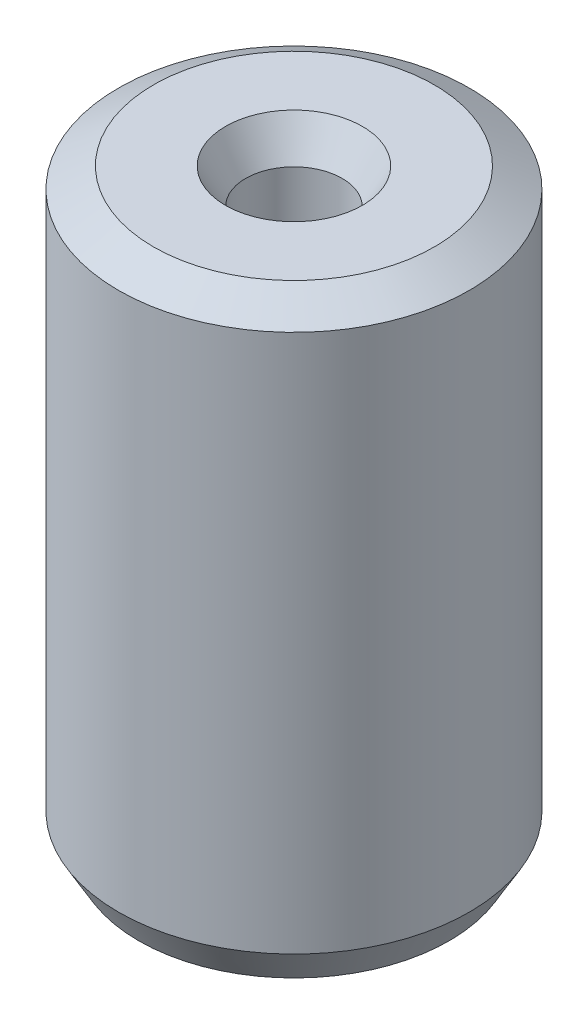
from build123d import *
from OCP.BRepFilletAPI import BRepFilletAPI_MakeChamfer

# Parameters (mm, degrees)
SKETCH1_R           = 5
BOSS_EXTRUDE1_DEPTH = 16.924427197
SKETCH2_R           = 1.376267349
CUT_EXTRUDE1_DEPTH  = 19.342198231
CHAMFER1_SIZE       = 0.575378494
CHAMFER1_SIZE2      = 0.996584786


with BuildPart() as part:
    # Sketch1 → Boss-Extrude1 (new body)
    with BuildSketch(Plane(origin=(0, 0, 0), x_dir=(1, 0, 0), z_dir=(0, 1, 0))):
        Circle(SKETCH1_R)
    extrude(amount=BOSS_EXTRUDE1_DEPTH)

    # Sketch2 → Cut-Extrude1 (cut, through all)
    with BuildSketch(Plane(origin=(0, 0, 0), x_dir=(1, 0, 0), z_dir=(0, 1, 0))):
        Circle(SKETCH2_R)
    extrude(amount=CUT_EXTRUDE1_DEPTH, mode=Mode.SUBTRACT)

    # Chamfer1: one chamfer whose edges measure the first distance from different faces: ONE call of the kernel's chamfer builder (chamfer() names one face for all edges)
    chamfer1_edges_1 = [part.edges().sort_by_distance(p)[0] for p in [
        (-1.376267349, 16.924427197, 0),
    ]]
    chamfer1_side_1 = [part.faces().sort_by_distance(p)[0] for p in [
        (-4.858578644, 16.924427197, 0),
    ]]
    chamfer1_edges_2 = [part.edges().sort_by_distance(p)[0] for p in [
        (-1.376267349, 0, 0),
    ]]
    chamfer1_side_2 = [part.faces().sort_by_distance(p)[0] for p in [
        (-1.376267349, 8.462213598, 0),
    ]]
    chamfer1_edges_3 = [part.edges().sort_by_distance(p)[0] for p in [
        (-5, 0, 0),
    ]]
    chamfer1_side_3 = [part.faces().sort_by_distance(p)[0] for p in [
        (-4.858578644, 0, 0),
    ]]
    chamfer1_edges_4 = [part.edges().sort_by_distance(p)[0] for p in [
        (-5, 16.924427197, 0),
    ]]
    chamfer1_side_4 = [part.faces().sort_by_distance(p)[0] for p in [
        (-5, 8.462213598, 0),
    ]]
    chamfer1 = BRepFilletAPI_MakeChamfer(part.part.solid().wrapped)
    for e in chamfer1_edges_1:
        chamfer1.Add(CHAMFER1_SIZE, CHAMFER1_SIZE2, e.wrapped, chamfer1_side_1[0].wrapped)  # the first distance lies on this face
    for e in chamfer1_edges_2:
        chamfer1.Add(CHAMFER1_SIZE, CHAMFER1_SIZE2, e.wrapped, chamfer1_side_2[0].wrapped)  # the first distance lies on this face
    for e in chamfer1_edges_3:
        chamfer1.Add(CHAMFER1_SIZE, CHAMFER1_SIZE2, e.wrapped, chamfer1_side_3[0].wrapped)  # the first distance lies on this face
    for e in chamfer1_edges_4:
        chamfer1.Add(CHAMFER1_SIZE, CHAMFER1_SIZE2, e.wrapped, chamfer1_side_4[0].wrapped)  # the first distance lies on this face
    add(Compound.cast(chamfer1.Shape()), mode=Mode.REPLACE)


solid = part.part
